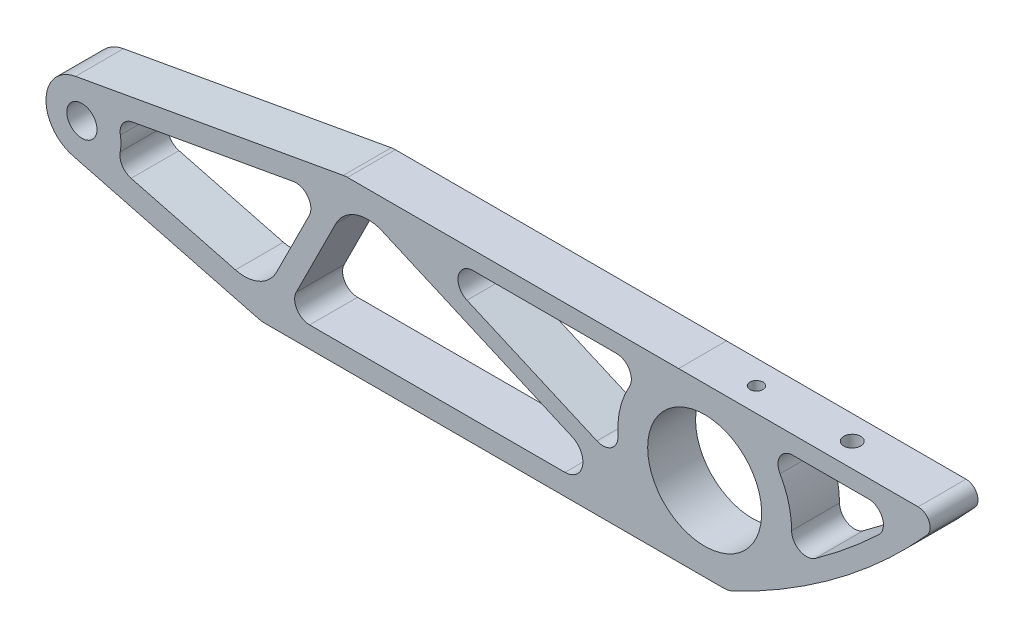
from build123d import *
from OCP.BRepFilletAPI import BRepFilletAPI_MakeFillet

# Parameters (mm, degrees)
SKETCH1_W           = 241.3
SKETCH1_H           = 44.45
BOSS_EXTRUDE1_DEPTH = 12.7
SKETCH3_R           = 4
CUT_EXTRUDE1_DEPTH  = 124.335571207
CUT_EXTRUDE2_DEPTH  = 124.335571207
SKETCH11_R          = 15.113
CUT_EXTRUDE3_DEPTH  = 124.335571207
CUT_EXTRUDE5_DEPTH  = 124.335571207
FILLET1_R1          = 6.35
FILLET1_R2          = 3.175
CUT_EXTRUDE6_REACH  = 128.244
SKETCH17_R          = 2.2479
SKETCH17_R_2        = 1.7272


with BuildPart() as part:
    # Sketch1 → Boss-Extrude1 (new body)
    with BuildSketch(Plane.XY):
        Rectangle(SKETCH1_W, SKETCH1_H)
    extrude(amount=BOSS_EXTRUDE1_DEPTH)

    # Sketch3 → Cut-Extrude1 (cut, through all)
    with BuildSketch(Plane.XY.offset(12.7)):
        with Locations((-107.95, 0)):
            Circle(SKETCH3_R)
    extrude(amount=-CUT_EXTRUDE1_DEPTH, mode=Mode.SUBTRACT)

    # Sketch5 → Cut-Extrude2 (cut, through all)
    with BuildSketch(Plane.XY.offset(12.7)):
        with BuildLine():
            Line((-60.325, -22.225), (-110.34695388, -9.218472601))
            ThreePointArc((-110.34695388, -9.218472601), (-117.468006846, 0.364925571), (-109.634072253, 9.374941368))
            Line((-109.634072253, 9.374941368), (-38.1, 22.225))
            Line((-38.1, 22.225), (-120.65, 22.225))
            Line((-120.65, 22.225), (-120.65, -22.225))
            Line((-120.65, -22.225), (-60.325, -22.225))
        make_face()
        with BuildLine():
            ThreePointArc((120.65, 22.225), (94.541588466, -3.171328028), (63.5, -22.225))
            Line((63.5, -22.225), (120.65, -22.225))
            Line((120.65, -22.225), (120.65, 22.225))
        make_face()
    extrude(amount=-CUT_EXTRUDE2_DEPTH, mode=Mode.SUBTRACT)

    # Sketch11 → Cut-Extrude3 (cut, through all)
    with BuildSketch(Plane(origin=(0, 0, 0), x_dir=(-1, 0, 0), z_dir=(0, 0, -1))):
        with Locations((-57.15, 0)):
            Circle(SKETCH11_R)
    extrude(amount=-CUT_EXTRUDE3_DEPTH, mode=Mode.SUBTRACT)

    # Sketch14 → Cut-Extrude5 (cut, through all)
    with BuildSketch(Plane.XY.offset(12.7)):
        with BuildLine():
            Line((-51.125302607, -10.925121043), (-40.656007501, 10.013469169))
            ThreePointArc((-40.656007501, 10.013469169), (-35.379139144, 14.709846449), (-28.318789113, 14.480158287))
            Line((-28.318789113, 14.480158287), (22.019974269, -7.543050693))
            ThreePointArc((22.019974269, -7.543050693), (24.772680677, -12.881357571), (20.111074572, -16.66875))
            Line((20.111074572, -16.66875), (-47.575544693, -16.66875))
            ThreePointArc((-47.575544693, -16.66875), (-50.951565089, -14.786495351), (-51.125302607, -10.925121043))
        make_face()
        with BuildLine():
            Line((-5.871359091, 9.857750577), (28.586323603, -5.217485601))
            ThreePointArc((28.586323603, -5.217485601), (32.445679586, -4.837926307), (34.139019098, -1.349187974))
            ThreePointArc((34.139019098, -1.349187974), (34.717999157, 5.303855994), (37.179868392, 11.511706816))
            ThreePointArc((37.179868392, 11.511706816), (37.177849969, 15.479290565), (33.741484851, 17.4625))
            Line((33.741484851, 17.4625), (-4.280609343, 17.4625))
            ThreePointArc((-4.280609343, 17.4625), (-8.165281097, 14.306339642), (-5.871359091, 9.857750577))
        make_face()
        with BuildLine():
            Line((-47.666566945, 8.416502982), (-56.327812786, -8.905988701))
            ThreePointArc((-56.327812786, -8.905988701), (-60.907881879, -13.318484653), (-67.244185661, -13.864751805))
            Line((-67.244185661, -13.864751805), (-94.912340261, -6.670578388))
            ThreePointArc((-94.912340261, -6.670578388), (-97.278793894, -4.933475515), (-97.804097466, -2.045277921))
            ThreePointArc((-97.804097466, -2.045277921), (-97.600580405, -0.109608648), (-97.763055837, 1.829936779))
            ThreePointArc((-97.763055837, 1.829936779), (-97.115123402, 4.797577595), (-94.558527039, 6.437859121))
            Line((-94.558527039, 6.437859121), (-51.918021631, 14.097607509))
            ThreePointArc((-51.918021631, 14.097607509), (-48.038810071, 12.569275194), (-47.666566945, 8.416502982))
        make_face()
        with BuildLine():
            Line((100.573095612, 17.4625), (80.558515149, 17.4625))
            ThreePointArc((80.558515149, 17.4625), (77.122150031, 15.479290565), (77.120131608, 11.511706816))
            ThreePointArc((77.120131608, 11.511706816), (79.419190596, 5.950521023), (80.200494292, -0.016222157))
            ThreePointArc((80.200494292, -0.016222157), (82.353386148, -3.547986655), (86.47861514, -3.24667356))
            ThreePointArc((86.47861514, -3.24667356), (95.124383856, 3.395096463), (103.298808872, 10.609055252))
            ThreePointArc((103.298808872, 10.609055252), (104.260886878, 14.960437472), (100.573095612, 17.4625))
        make_face()
    extrude(amount=-CUT_EXTRUDE5_DEPTH, mode=Mode.SUBTRACT)

    # Fillet1: one fillet with a radius per group of edges: ONE call of the kernel's fillet builder (fillet() takes one radius for all edges)
    fillet1_edges_1 = [part.edges().sort_by_distance(p)[0] for p in [
        (63.5, -22.225, 6.35),
        (-60.325, -22.225, 6.35),
        (-38.1, 22.225, 6.35),
    ]]
    fillet1_edges_2 = [part.edges().sort_by_distance(p)[0] for p in [
        (120.65, 22.225, 6.35),
    ]]
    fillet1 = BRepFilletAPI_MakeFillet(part.part.solid().wrapped)
    for e in fillet1_edges_1:
        fillet1.Add(FILLET1_R1, e.wrapped)
    for e in fillet1_edges_2:
        fillet1.Add(FILLET1_R2, e.wrapped)
    add(Compound.cast(fillet1.Shape()), mode=Mode.REPLACE)

    # Sketch17 → Cut-Extrude6 (cut, up to next)
    with BuildSketch(Plane(origin=(0, 22.225, 0), x_dir=(1, 0, 0), z_dir=(0, 1, 0)), mode=Mode.PRIVATE) as cut_extrude6_sk1:
        with Locations((89.924281862, -6.35)):
            Circle(SKETCH17_R)
    cut_extrude6_tool1 = extrude(cut_extrude6_sk1.sketch, amount=-CUT_EXTRUDE6_REACH, mode=Mode.PRIVATE) & part.part
    # Sketch17 → Cut-Extrude6 (cut, up to next)
    with BuildSketch(Plane(origin=(0, 22.225, 0), x_dir=(1, 0, 0), z_dir=(0, 1, 0)), mode=Mode.PRIVATE) as cut_extrude6_sk2:
        with Locations((64.524281862, -6.35)):
            Circle(SKETCH17_R_2)
    cut_extrude6_tool2 = extrude(cut_extrude6_sk2.sketch, amount=-CUT_EXTRUDE6_REACH, mode=Mode.PRIVATE) & part.part
    add(cut_extrude6_tool1.solids().sort_by_distance((89.924282, 22.225, 6.35))[0], mode=Mode.SUBTRACT)
    add(cut_extrude6_tool2.solids().sort_by_distance((64.524282, 22.225, 6.35))[0], mode=Mode.SUBTRACT)


solid = part.part
